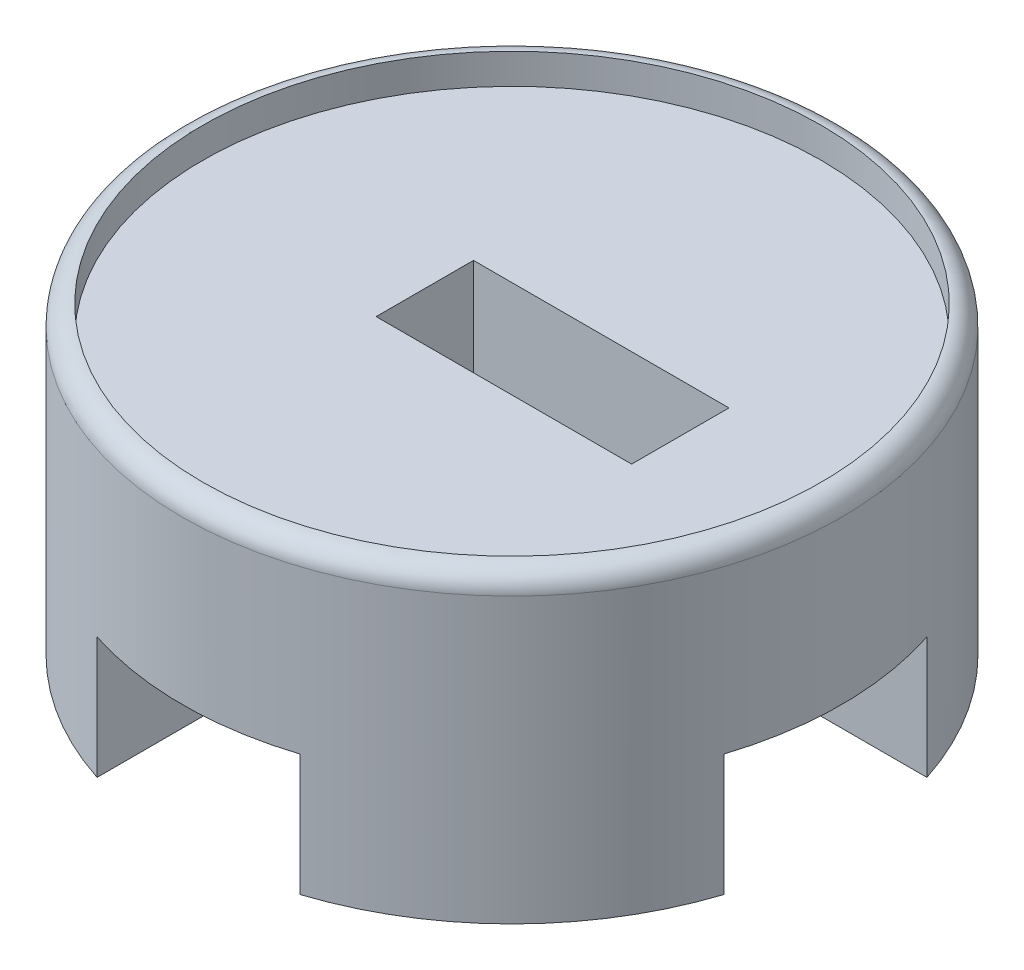
from build123d import *

# Parameters (mm, degrees)
SKETCH2_R           = 41.275
BOSS_EXTRUDE2_DEPTH = 38.1
SKETCH3_R           = 38.735
CUT_EXTRUDE1_DEPTH  = 3.81
SKETCH4_W           = 25.4
SKETCH4_H           = 25.4
CUT_EXTRUDE2_DEPTH  = 15.24
SKETCH5_W           = 32.004
SKETCH5_H           = 12.192
CUT_EXTRUDE3_DEPTH  = 13.97
SKETCH6_W           = 22.606
SKETCH6_H           = 12.192
CUT_EXTRUDE4_DEPTH  = 62.807391548
FILLET1_R           = 2.54


with BuildPart() as part:
    # Sketch2 → Boss-Extrude2 (new body)
    with BuildSketch(Plane(origin=(0, 0, 0), x_dir=(1, 0, 0), z_dir=(0, 1, 0))):
        with Locations(Location((0, 0, 0), (0, 0, 90))):
            Circle(SKETCH2_R)
    extrude(amount=BOSS_EXTRUDE2_DEPTH)

    # Sketch3 → Cut-Extrude1 (cut)
    with BuildSketch(Plane(origin=(0, 38.1, 0), x_dir=(1, 0, 0), z_dir=(0, 1, 0))):
        with Locations(Location((0, 0, 0), (0, 0, 270))):
            Circle(SKETCH3_R)
    extrude(amount=-CUT_EXTRUDE1_DEPTH, mode=Mode.SUBTRACT)

    # Sketch4 → Cut-Extrude2 (cut)
    with BuildSketch(Plane.XZ):
        with BuildLine():
            ThreePointArc((-12.7, -39.272581084), (-6.428446216, -40.771322081), (-6e-08, -41.275))
            ThreePointArc((-6e-08, -41.275), (6.428446158, -40.77132209), (12.7, -39.272581084))
            Line((12.7, -39.272581084), (12.7, -12.7))
            Line((12.7, -12.7), (-12.7, -12.7))
            Line((-12.7, -12.7), (-12.7, -39.272581084))
        make_face()
        Rectangle(SKETCH4_W, SKETCH4_H)
        with BuildLine():
            Line((-12.7, 39.272581084), (-12.7, 12.7))
            Line((-12.7, 12.7), (12.7, 12.7))
            Line((12.7, 12.7), (12.7, 39.272581084))
            ThreePointArc((12.7, 39.272581084), (6.428446095, 40.7713221), (-1.86e-07, 41.275))
            ThreePointArc((-1.86e-07, 41.275), (-6.428446279, 40.771322071), (-12.7, 39.272581084))
        make_face()
        with BuildLine():
            Line((12.7, 12.7), (12.7, -12.7))
            Line((12.7, -12.7), (39.272581084, -12.7))
            ThreePointArc((39.272581084, -12.7), (40.771322086, -6.428446187), (41.275, 0))
            ThreePointArc((41.275, 0), (40.771322086, 6.428446187), (39.272581084, 12.7))
            Line((39.272581084, 12.7), (12.7, 12.7))
        make_face()
        with BuildLine():
            Line((-39.272581084, -12.7), (-12.7, -12.7))
            Line((-12.7, -12.7), (-12.7, 12.7))
            Line((-12.7, 12.7), (-39.272581084, 12.7))
            ThreePointArc((-39.272581084, 12.7), (-40.77132209, 6.428446159), (-41.275, -5.7e-08))
            ThreePointArc((-41.275, -5.7e-08), (-40.771322081, -6.428446215), (-39.272581084, -12.7))
        make_face()
    extrude(amount=-CUT_EXTRUDE2_DEPTH, mode=Mode.SUBTRACT)

    # Sketch5 → Cut-Extrude3 (cut)
    with BuildSketch(Plane(origin=(0, 34.29, 0), x_dir=(1, 0, 0), z_dir=(0, 1, 0))):
        with Locations((5.08, 0)):
            Rectangle(SKETCH5_W, SKETCH5_H)
    extrude(amount=-CUT_EXTRUDE3_DEPTH, mode=Mode.SUBTRACT)

    # Sketch6 → Cut-Extrude4 (cut, through all)
    with BuildSketch(Plane(origin=(0, 20.32, 0), x_dir=(1, 0, 0), z_dir=(0, 1, 0))):
        with Locations((5.08, 0)):
            Rectangle(SKETCH6_W, SKETCH6_H)
    extrude(amount=-CUT_EXTRUDE4_DEPTH, mode=Mode.SUBTRACT)

    # Fillet1
    fillet1_edges = [part.edges().sort_by_distance(p)[0] for p in [
        (12.7, 7.62, 12.7),
        (-12.7, 7.62, 12.7),
        (-12.7, 7.62, -12.7),
        (12.7, 7.62, -12.7),
        (0, 38.1, 41.275),
    ]]
    fillet(fillet1_edges, radius=FILLET1_R - 0.0001)  # a hair under: the kernel refuses the full size


solid = part.part
